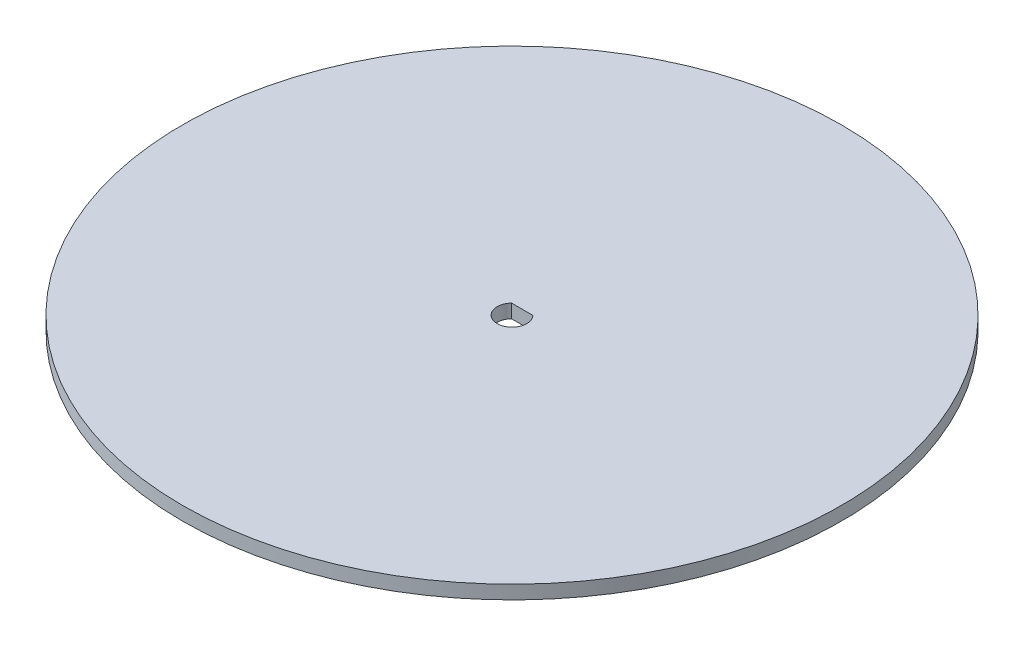
from build123d import *

# Parameters (mm, degrees)
SKETCH1_R          = 72.5
BASE_FLANGE1_DEPTH = 3
CUT_EXTRUDE1_REACH = 104.574


# Sheet-metal steps are written as plain solids
with BuildPart() as part:
    # Sketch1 → Base-Flange1 (new body)
    with BuildSketch(Plane(origin=(0, 0, 0), x_dir=(1, 0, 0), z_dir=(0, 1, 0))):
        with Locations(Location((0, 0, 0), (0, 0, 270))):
            Circle(SKETCH1_R)
    extrude(amount=-BASE_FLANGE1_DEPTH)

    # Sketch6 → Cut-Extrude1 (cut, up to next)
    with BuildSketch(Plane(origin=(0, 0, 0), x_dir=(1, 0, 0), z_dir=(0, 1, 0)), mode=Mode.PRIVATE) as cut_extrude1_sk1:
        with BuildLine():
            Line((-2.34520788, 2.25), (2.34520788, 2.25))
            ThreePointArc((2.34520788, 2.25), (0, -3.25), (-2.34520788, 2.25))
        make_face()
    cut_extrude1_tool1 = extrude(cut_extrude1_sk1.sketch, amount=-CUT_EXTRUDE1_REACH, mode=Mode.PRIVATE) & part.part
    add(cut_extrude1_tool1.solids().sort_by_distance((0, 0, 0.287161))[0], mode=Mode.SUBTRACT)


solid = part.part
